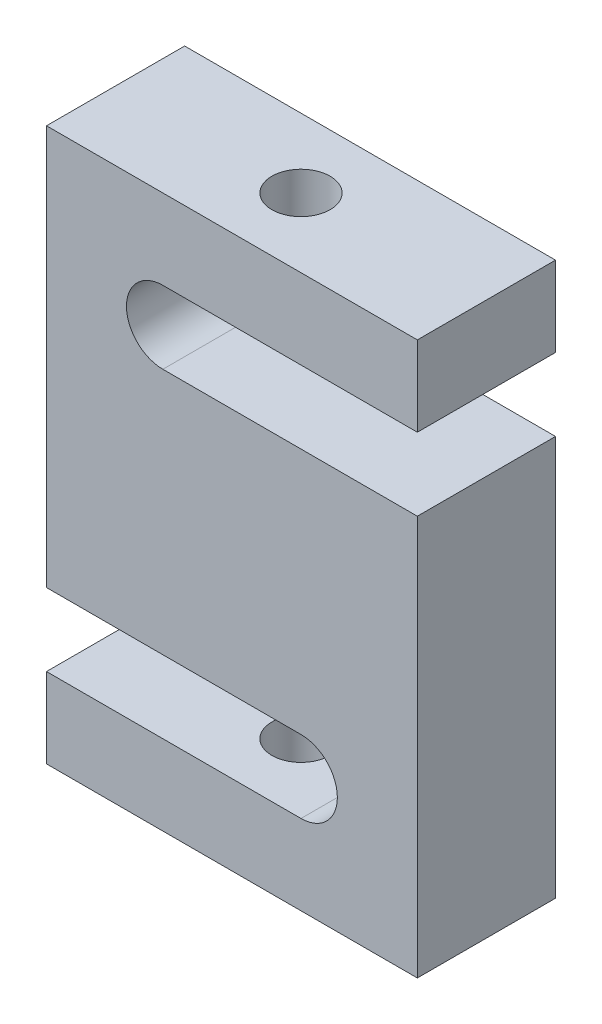
from build123d import *

# Parameters (mm, degrees)
SKETCH_1_W          = 51
SKETCH_1_H          = 76
EXTRUDE_1_DEPTH     = 19
CUT_EXTRUDE_2_DEPTH = 50.550479312
SKETCH_2_R          = 4
CUT_EXTRUDE_1_DEPTH = 19


with BuildPart() as part:
    # 草图1 → 凸台-拉伸1 (new body)
    with BuildSketch(Plane.XY):
        Rectangle(SKETCH_1_W, SKETCH_1_H)
    extrude(amount=EXTRUDE_1_DEPTH)

    # 草图3 → 切除-拉伸2 (cut, through all)
    with BuildSketch(Plane(origin=(0, 0, 0), x_dir=(-1, 0, 0), z_dir=(0, 0, -1))):
        with BuildLine():
            Line((-25.5, 27), (9.5, 27))
            ThreePointArc((9.5, 27), (14.5, 22), (9.5, 17))
            Line((9.5, 17), (-25.5, 17))
            Line((-25.5, 17), (-25.5, 27))
        make_face()
        with BuildLine():
            Line((25.5, -27), (-9.5, -27))
            ThreePointArc((-9.5, -27), (-14.5, -22), (-9.5, -17))
            Line((-9.5, -17), (25.5, -17))
            Line((25.5, -17), (25.5, -27))
        make_face()
    extrude(amount=-CUT_EXTRUDE_2_DEPTH, mode=Mode.SUBTRACT)

    # 草图2 → 切除-拉伸1 (cut)
    with BuildSketch(Plane(origin=(0, 38, 0), x_dir=(1, 0, 0), z_dir=(0, 1, 0))):
        with Locations((0, -9.5)):
            Circle(SKETCH_2_R)
    cut_extrude_1 = extrude(amount=-CUT_EXTRUDE_1_DEPTH, mode=Mode.SUBTRACT)

    # 镜向1: 切除-拉伸1 across plane
    add(cut_extrude_1.mirror(Plane.ZX), mode=Mode.SUBTRACT)


solid = part.part
